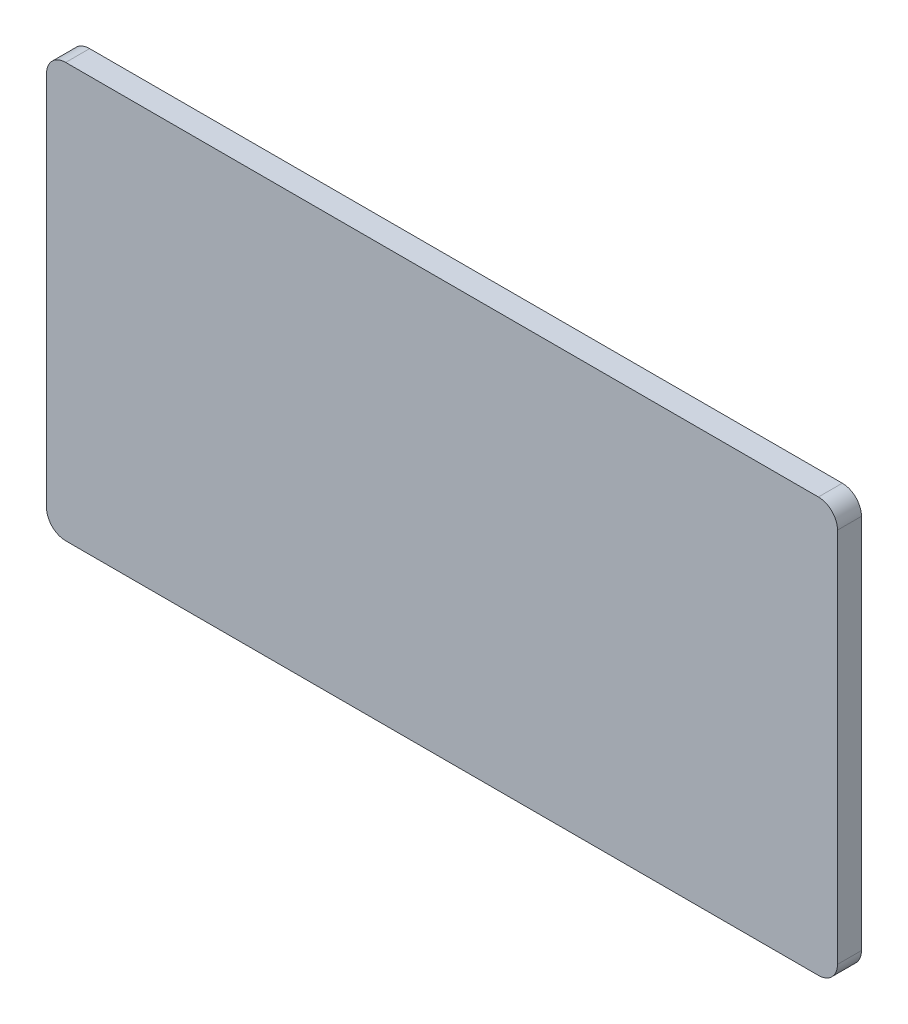
from build123d import *

# Parameters (mm, degrees)
SKETCH1_W           = 105
SKETCH1_H           = 55
BOSS_EXTRUDE1_DEPTH = 3.175
FILLET1_R           = 2.54


with BuildPart() as part:
    # Sketch1 → Boss-Extrude1 (new body)
    with BuildSketch(Plane.XY):
        Rectangle(SKETCH1_W, SKETCH1_H)
    extrude(amount=BOSS_EXTRUDE1_DEPTH)

    # Fillet1
    fillet1_edges = [part.edges().sort_by_distance(p)[0] for p in [
        (-52.5, -27.5, 1.5875),
        (-52.5, 27.5, 1.5875),
        (52.5, -27.5, 1.5875),
        (52.5, 27.5, 1.5875),
    ]]
    fillet(fillet1_edges, radius=FILLET1_R)


solid = part.part
